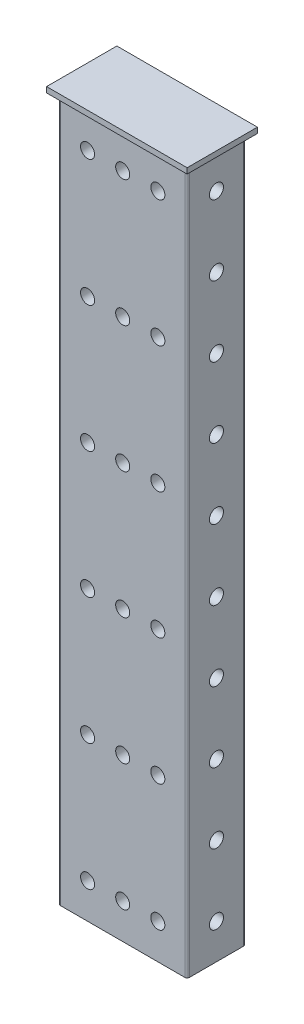
from build123d import *

# Parameters (mm, degrees)
SKETCH2_W           = 50.8
SKETCH2_H           = 25.4
BOSS_EXTRUDE2_DEPTH = 1.999996
SKETCH2_4_W         = 46.5836
SKETCH2_4_H         = 21.1836
BOSS_EXTRUDE3_DEPTH = 254
FILLET3_R           = 0.810638298
SKETCH3_R           = 2.54
CUT_EXTRUDE1_DEPTH  = 260.869296738
SKETCH4_R           = 2.54
CUT_EXTRUDE2_DEPTH  = 261.075273618
LPATTERN1_COUNT     = 10
LPATTERN1_PITCH     = 25.4
LPATTERN4_COUNT     = 6
LPATTERN4_PITCH     = 45.7199746


with BuildPart() as part:
    # Sketch2 → Boss-Extrude2 (new body)
    with BuildSketch(Plane(origin=(0, 0, 0), x_dir=(1, 0, 0), z_dir=(0, 1, 0))):
        with Locations((25.4, 12.7)):
            Rectangle(SKETCH2_W, SKETCH2_H)
    extrude(amount=BOSS_EXTRUDE2_DEPTH)

    # Sketch2<4> → Boss-Extrude3 (add)
    with BuildSketch(Plane(origin=(0, 0, 0), x_dir=(1, 0, 0), z_dir=(0, 1, 0))):
        with Locations((25.4, 12.7)):
            Rectangle(SKETCH2_4_W, SKETCH2_4_H)
    extrude(amount=-BOSS_EXTRUDE3_DEPTH)

    # Fillet3
    fillet3_edges = [part.edges().sort_by_distance(p)[0] for p in [
        (2.1082, -127, -23.2918),
        (48.6918, -127, -2.1082),
        (2.1082, -127, -2.1082),
        (48.6918, -127, -23.2918),
    ]]
    fillet(fillet3_edges, radius=FILLET3_R)

    # Sketch3 → Cut-Extrude1 (cut, through all)
    with BuildSketch(Plane(origin=(48.6918, 0, 0), x_dir=(0, 0, -1), z_dir=(1, 0, 0))):
        with Locations((12.7, -12.7)):
            Circle(SKETCH3_R)
    cut_extrude1 = extrude(amount=-CUT_EXTRUDE1_DEPTH, mode=Mode.SUBTRACT)

    # Sketch4 → Cut-Extrude2 (cut, through all)
    with BuildSketch(Plane(origin=(0, 0, -23.2918), x_dir=(-1, 0, 0), z_dir=(0, 0, -1))):
        with Locations((-25.4, -12.7)):
            Circle(SKETCH4_R)
        with Locations((-38.1, -12.7)):
            Circle(SKETCH4_R)
        with Locations((-12.7, -12.7)):
            Circle(SKETCH4_R)
    cut_extrude2 = extrude(amount=-CUT_EXTRUDE2_DEPTH, mode=Mode.SUBTRACT)

    # LPattern1: Cut-Extrude1 ×10
    with Locations(*[(0, -i * LPATTERN1_PITCH, 0) for i in range(1, LPATTERN1_COUNT)]):
        add(cut_extrude1, mode=Mode.SUBTRACT)

    # LPattern4: Cut-Extrude2 ×6
    with Locations(*[(0, -i * LPATTERN4_PITCH, 0) for i in range(1, LPATTERN4_COUNT)]):
        add(cut_extrude2, mode=Mode.SUBTRACT)


solid = part.part
